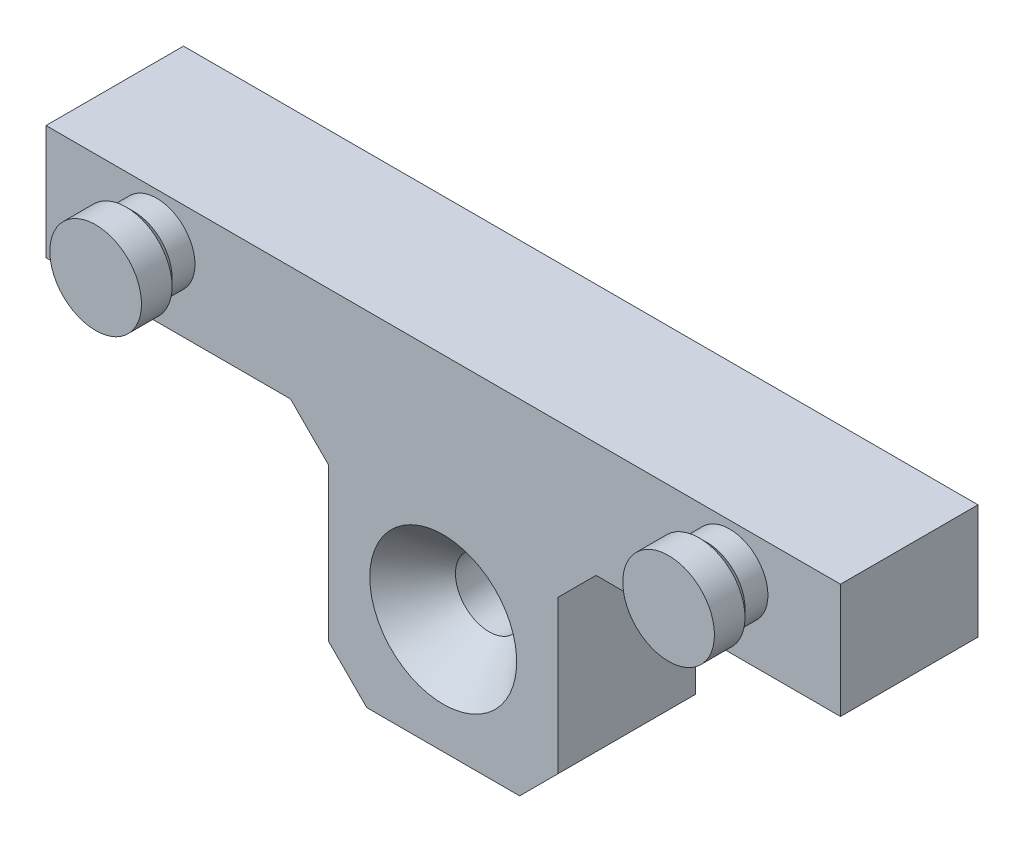
from build123d import *

# Parameters (mm, degrees)
SKETCH1_W                = 52
SKETCH1_H                = 7.5
SKETCH1_R                = 2.5
SKETCH1_W_2              = 15
SKETCH1_H_2              = 15
SKETCH1_R_2              = 2.2
BOSS_EXTRUDE1_DEPTH      = 9
BOSS_EXTRUDE2_DEPTH      = 1.5
BOSS_EXTRUDE2_DEPTH_BACK = 9
SKETCH2_R                = 2.5
SKETCH4_R                = 3
BOSS_EXTRUDE3_DEPTH      = 2.5
CHAMFER1_SIZE            = 0.5
CHAMFER2_SIZE            = 2.5
CUT_EXTRUDE1_DEPTH       = 2
CUT_EXTRUDE1_DEPTH_BACK  = 7
SKETCH5_R                = 1.25


with BuildPart() as part:
    # Sketch1 → Boss-Extrude1 (new body)
    # profile 1 of 2: a face of its own
    with BuildSketch(Plane.XY):
        with Locations((26, -3.75)):
            Rectangle(SKETCH1_W, SKETCH1_H)
        with Locations((7.25, -3)):
            Circle(SKETCH1_R, mode=Mode.SUBTRACT)
        with Locations((44.75, -3)):
            Circle(SKETCH1_R, mode=Mode.SUBTRACT)
    # profile 2 of 2: a face of its own
    with BuildSketch(Plane.XY):
        with Locations((26, -15)):
            Rectangle(SKETCH1_W_2, SKETCH1_H_2)
        with Locations((26, -15)):
            Circle(SKETCH1_R_2, mode=Mode.SUBTRACT)
    extrude(amount=BOSS_EXTRUDE1_DEPTH)

    # Sketch2 → Boss-Extrude2 (add, two sides: drawn at the far end of the back side and taken through both)
    with BuildSketch(Plane.XY.offset(9).offset(-BOSS_EXTRUDE2_DEPTH_BACK)):
        with Locations((7.25, -3)):
            Circle(SKETCH2_R)
        with Locations((44.75, -3)):
            Circle(SKETCH2_R)
    extrude(amount=BOSS_EXTRUDE2_DEPTH + BOSS_EXTRUDE2_DEPTH_BACK)

    # Sketch3 → Cut-Revolve1 (revolve, cut)
    with BuildSketch(Plane(origin=(0, -15, 0), x_dir=(1, 0, 0), z_dir=(0, 1, 0)), mode=Mode.PRIVATE) as cut_revolve1_sk:
        Polygon((26, -9), (30.807860213, -9), (28.2, -6), (26, -6), align=None)
    revolve(cut_revolve1_sk.sketch.rotate(Axis((26, -15, 6), (0, 0, 1)), 180), axis=Axis((26, -15, 6), (0, 0, 1)), mode=Mode.SUBTRACT)

    # Sketch4 → Boss-Extrude3 (add)
    with BuildSketch(Plane.XY.offset(10.5)):
        with Locations((7.25, -3)):
            Circle(SKETCH4_R)
        with Locations((44.75, -3)):
            Circle(SKETCH4_R)
    extrude(amount=BOSS_EXTRUDE3_DEPTH)

    # Chamfer1
    chamfer1_edges = [part.edges().sort_by_distance(p)[0] for p in [
        (4.25, -3, 10.5),
        (41.75, -3, 10.5),
    ]]
    chamfer(chamfer1_edges, length=CHAMFER1_SIZE - 0.0001)  # a hair under: the kernel refuses the full size

    # Chamfer2
    chamfer2_edges = [part.edges().sort_by_distance(p)[0] for p in [
        (33.5, -7.5, 4.5),
        (33.5, -22.5, 4.5),
        (18.5, -22.5, 4.5),
        (18.5, -7.5, 4.5),
    ]]
    chamfer(chamfer2_edges, length=CHAMFER2_SIZE)

    # Sketch5 → Cut-Extrude1 (cut, two sides: drawn at the far end of the back side and taken through both)
    with BuildSketch(Plane.XY.offset(9).offset(-CUT_EXTRUDE1_DEPTH_BACK)):
        with Locations((7.25, -3)):
            Circle(SKETCH5_R)
        with Locations((44.75, -3)):
            Circle(SKETCH5_R)
    extrude(amount=CUT_EXTRUDE1_DEPTH + CUT_EXTRUDE1_DEPTH_BACK, mode=Mode.SUBTRACT)


solid = part.part
